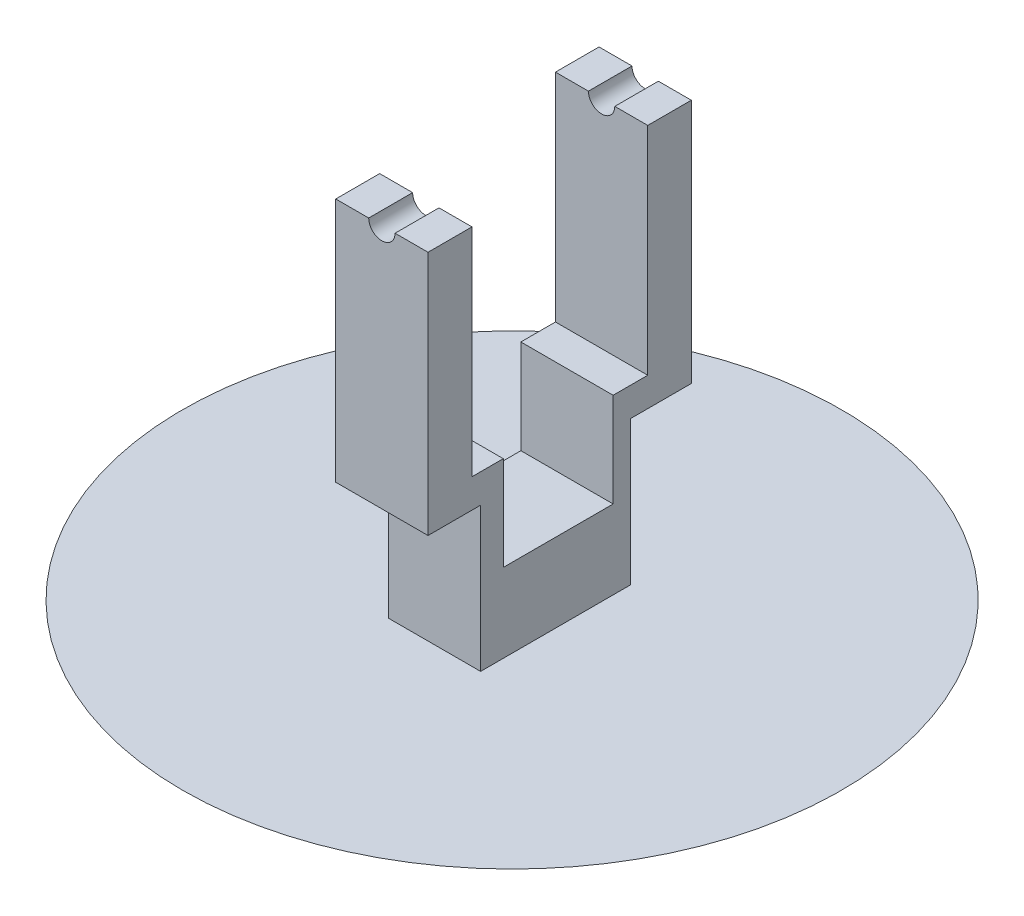
from build123d import *

# Parameters (mm, degrees)
BOSS_EXTRUDE1_DEPTH     = 21
CUT_EXTRUDE1_DEPTH      = 304.596922143
CUT_EXTRUDE1_DEPTH_BACK = 304.596922143
SKETCH3_R               = 6


with BuildPart() as part:
    # Sketch1 → Boss-Extrude1 (new, symmetric)
    with BuildSketch(Plane(origin=(0, 0, 0), x_dir=(0, 0, -1), z_dir=(1, 0, 0))):
        Polygon((-59.255127744, 0), (-39.255127744, 0), (-39.255127744, -98.490344249), (-25, -98.490344249), (-25, -141.353326758), (25, -141.353326758), (25, -98.490344249), (40.744872256, -98.490344249), (40.744872256, 0), (60.58315799, 0), (60.58315799, -111.658150414), (32.872436128, -111.658150414), (32.872436128, -177.189067715), (-35.313661989, -177.189067715), (-35.313661989, -111.658150414), (-59.255127744, -111.658150414), align=None)
    extrude(amount=BOSS_EXTRUDE1_DEPTH, both=True)

    # Sketch2 → Revolve1 (revolve)
    with BuildSketch(Plane.XY):
        Polygon((79.954646314, -217.189067715), (150, -177.189067715), (21, -177.189067715), (0, -177.189067715), (0, -217.189067715), align=None)
    revolve(axis=Axis((0, 87.726376394, 0), (0, -1, 0)))

    # Sketch3 → Cut-Extrude1 (cut, two sides: drawn at the far end of the back side and taken through both)
    with BuildSketch(Plane.XY.offset(-CUT_EXTRUDE1_DEPTH_BACK)):
        Circle(SKETCH3_R)
    extrude(amount=CUT_EXTRUDE1_DEPTH + CUT_EXTRUDE1_DEPTH_BACK, mode=Mode.SUBTRACT)


solid = part.part
